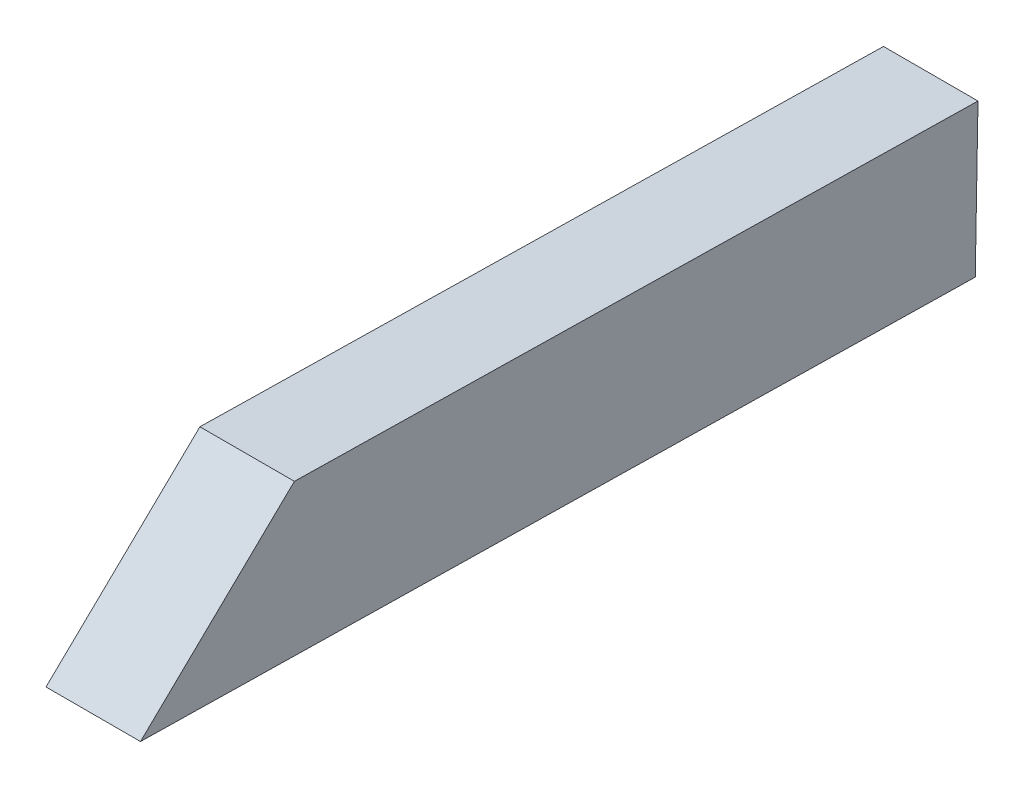
from build123d import *

# Parameters (mm, degrees)
SKETCH2_W           = 3.175
SKETCH2_H           = 28.055216984
BOSS_EXTRUDE1_DEPTH = 5.08
CHAMFER1_SIZE       = 5.08


with BuildPart() as part:
    # Sketch2 → Boss-Extrude1 (new body)
    with BuildSketch(Plane(origin=(0, 1065.810275743, -19.39007848), x_dir=(1, 0, 0), z_dir=(4.449407192603594e-15, 0.9998345519923184, -0.018189795004890538))):
        with Locations((671.194724889, -1291.239942416)):
            Rectangle(SKETCH2_W, SKETCH2_H)
    extrude(amount=BOSS_EXTRUDE1_DEPTH)

    # Chamfer1
    chamfer1_edges = [part.edges().sort_by_distance(p)[0] for p in [
        (671.194724889, 1094.631984445, 1285.569114354),
    ]]
    chamfer(chamfer1_edges, length=CHAMFER1_SIZE - 0.0001)  # a hair under: the kernel refuses the full size


solid = part.part
